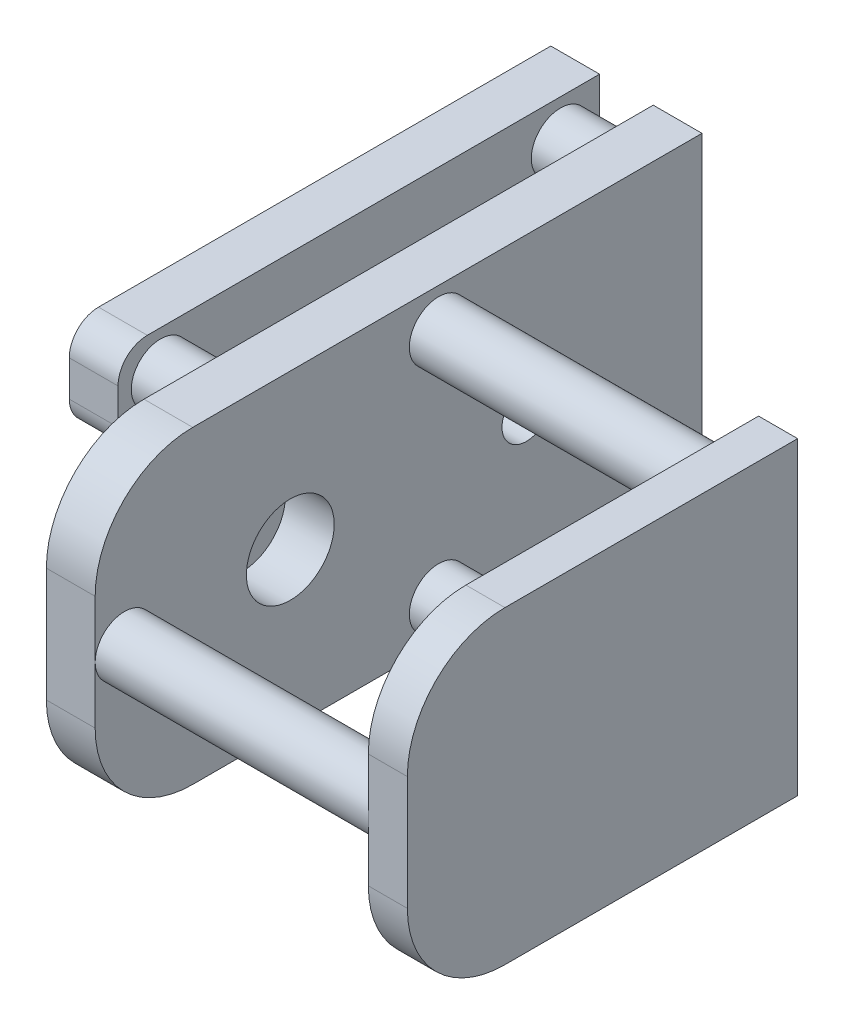
from build123d import *

# Parameters (mm, degrees)
SKETCH_1_R      = 4.5
SKETCH_1_R_2    = 2.5
EXTRUDE_1_DEPTH = 5
SKETCH_2_R      = 3
EXTRUDE_2_DEPTH = 28
EXTRUDE_3_DEPTH = 4
SKETCH_5_R      = 3
EXTRUDE_4_DEPTH = 5.5
EXTRUDE_6_DEPTH = 5
SKETCH_7_R      = 1.6
EXTRUDE_7_DEPTH = 1


with BuildPart() as part:
    # 草图1 → 凸台-拉伸1 (new body)
    with BuildSketch(Plane(origin=(0, 0, 0), x_dir=(0, 0, -1), z_dir=(1, 0, 0))):
        with BuildLine():
            Line((31.1, -15.85), (-21.1, -15.85))
            ThreePointArc((-21.1, -15.85), (-28.171067812, -12.921067812), (-31.1, -5.85))
            Line((-31.1, -5.85), (-31.1, 5.85))
            ThreePointArc((-31.1, 5.85), (-28.171067812, 12.921067812), (-21.1, 15.85))
            Line((-21.1, 15.85), (31.1, 15.85))
            Line((31.1, 15.85), (31.1, -15.85))
        make_face()
        with Locations((-11.1, 0)):
            Circle(SKETCH_1_R, mode=Mode.SUBTRACT)
        with Locations((13.1, 0)):
            Circle(SKETCH_1_R_2, mode=Mode.SUBTRACT)
    extrude(amount=EXTRUDE_1_DEPTH)

    # 草图2 → 凸台-拉伸2 (add)
    with BuildSketch(Plane(origin=(5, 0, 0), x_dir=(0, 0, -1), z_dir=(1, 0, 0))):
        with Locations((-28.1, 0)):
            Circle(SKETCH_2_R)
        with Locations((4.1, 11.85)):
            Circle(SKETCH_2_R)
        with Locations((4.1, -11.85)):
            Circle(SKETCH_2_R)
    extrude(amount=EXTRUDE_2_DEPTH)

    # 草图3 → 凸台-拉伸3 (add)
    with BuildSketch(Plane(origin=(33, 0, 0), x_dir=(0, 0, -1), z_dir=(1, 0, 0))):
        with BuildLine():
            Line((8.9, 15.85), (-21.1, 15.85))
            ThreePointArc((-21.1, 15.85), (-28.171067812, 12.921067812), (-31.1, 5.85))
            Line((-31.1, 5.85), (-31.1, 0))
            Line((-31.1, 0), (-31.1, -5.85))
            ThreePointArc((-31.1, -5.85), (-28.171067812, -12.921067812), (-21.1, -15.85))
            Line((-21.1, -15.85), (8.9, -15.85))
            Line((8.9, -15.85), (8.9, 15.85))
        make_face()
    extrude(amount=EXTRUDE_3_DEPTH)

    # 草图5 → 凸台-拉伸4 (add)
    with BuildSketch(Plane.ZY):
        with Locations((-27.1, 11.85)):
            Circle(SKETCH_5_R)
        with Locations((-27.1, -11.978090594)):
            Circle(SKETCH_5_R)
        with Locations((13.9, 11.85)):
            Circle(SKETCH_5_R)
        with Locations((13.9, -11.978090594)):
            Circle(SKETCH_5_R)
    extrude(amount=EXTRUDE_4_DEPTH)

    # 草图6 → 凸台-拉伸6 (add)
    with BuildSketch(Plane.ZY.offset(5.5)):
        with BuildLine():
            Line((15.255672946, -15.85), (-31.1, -15.85))
            Line((-31.1, -15.85), (-31.1, 15.85))
            Line((-31.1, 15.85), (15.255672946, 15.85))
            ThreePointArc((15.255672946, 15.85), (17.376993289, 14.971320344), (18.255672946, 12.85))
            Line((18.255672946, 12.85), (18.255672946, 9.183659284))
            ThreePointArc((18.255672946, 9.183659284), (17.376993289, 7.062338941), (15.255672946, 6.183659284))
            Line((15.255672946, 6.183659284), (8.696116264, 6.183659284))
            ThreePointArc((8.696116264, 6.183659284), (6.574795921, 5.304979628), (5.696116264, 3.183659284))
            Line((5.696116264, 3.183659284), (5.696116264, -3.183659284))
            ThreePointArc((5.696116264, -3.183659284), (6.574795921, -5.304979628), (8.696116264, -6.183659284))
            Line((8.696116264, -6.183659284), (15.255672946, -6.183659284))
            ThreePointArc((15.255672946, -6.183659284), (17.376993289, -7.062338941), (18.255672946, -9.183659284))
            Line((18.255672946, -9.183659284), (18.255672946, -12.85))
            ThreePointArc((18.255672946, -12.85), (17.376993289, -14.971320344), (15.255672946, -15.85))
        make_face()
    extrude(amount=EXTRUDE_6_DEPTH)

    # 草图7 → 凸台-拉伸7 (add)
    with BuildSketch(Plane.XZ.offset(15.85)):
        with Locations((2.5, 10.7)):
            Circle(SKETCH_7_R)
        with Locations((2.5, -23.1)):
            Circle(SKETCH_7_R)
    extrude(amount=EXTRUDE_7_DEPTH)


solid = part.part
